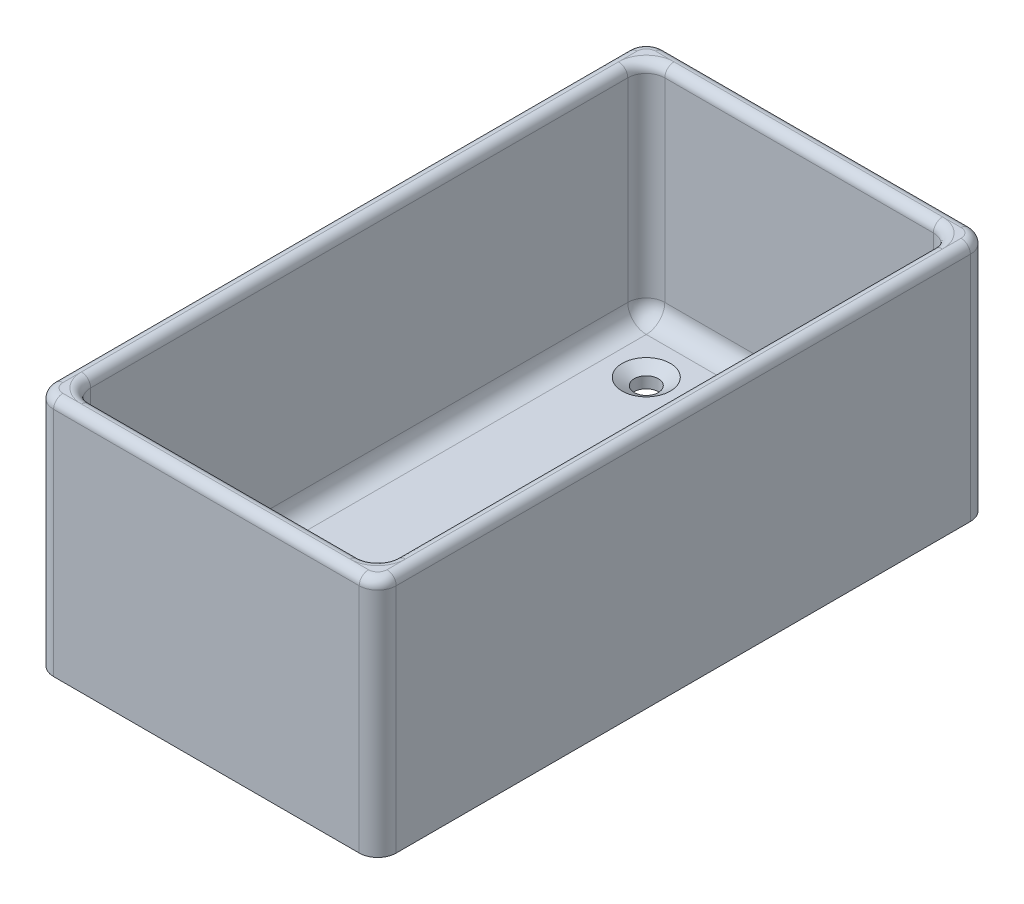
from build123d import *

# Parameters (mm, degrees)
SKETCH1_W           = 58.7375
SKETCH1_H           = 104.775
SKETCH1_W_2         = 52.3875
SKETCH1_H_2         = 98.425
EXTRUDE_THIN1_DEPTH = 38.1
FILLET1_R           = 3.175
BOSS_EXTRUDE1_DEPTH = 3.175
FILLET2_R           = 3.175
SKETCH3_R           = 2.06375
CUT_EXTRUDE1_DEPTH  = 3.175
CIRPATTERN1_COUNT   = 2
FILLET3_R           = 1.5875


with BuildPart() as part:
    # Sketch1 → Extrude-Thin1 (new body)
    with BuildSketch(Plane(origin=(0, 0, 0), x_dir=(1, 0, 0), z_dir=(0, 1, 0))):
        Rectangle(SKETCH1_W, SKETCH1_H)
        Rectangle(SKETCH1_W_2, SKETCH1_H_2, mode=Mode.SUBTRACT)
    extrude(amount=EXTRUDE_THIN1_DEPTH)

    # Fillet1
    fillet1_edges = [part.edges().sort_by_distance(p)[0] for p in [
        (26.19375, 19.05, 49.2125),
        (26.19375, 19.05, -49.2125),
        (-26.19375, 19.05, -49.2125),
        (-26.19375, 19.05, 49.2125),
        (29.36875, 19.05, 52.3875),
        (-29.36875, 19.05, 52.3875),
        (-29.36875, 19.05, -52.3875),
        (29.36875, 19.05, -52.3875),
    ]]
    fillet(fillet1_edges, radius=FILLET1_R)

    # Sketch2 → Boss-Extrude1 (add)
    with BuildSketch(Plane.XZ):
        with BuildLine():
            Line((29.36875, -49.2125), (29.36875, 49.2125))
            ThreePointArc((29.36875, 49.2125), (28.43881403, 51.45756403), (26.19375, 52.3875))
            Line((26.19375, 52.3875), (-26.19375, 52.3875))
            ThreePointArc((-26.19375, 52.3875), (-28.43881403, 51.45756403), (-29.36875, 49.2125))
            Line((-29.36875, 49.2125), (-29.36875, -49.2125))
            ThreePointArc((-29.36875, -49.2125), (-28.43881403, -51.45756403), (-26.19375, -52.3875))
            Line((-26.19375, -52.3875), (26.19375, -52.3875))
            ThreePointArc((26.19375, -52.3875), (28.43881403, -51.45756403), (29.36875, -49.2125))
        make_face()
    extrude(amount=BOSS_EXTRUDE1_DEPTH)

    # Fillet2
    fillet2_edges = [part.edges().sort_by_distance(p)[0] for p in [
        (26.19375, 0, 0),
        (0, 0, -49.2125),
        (-26.19375, 0, 0),
        (0, 0, 49.2125),
        (-25.26381403, 0, 48.28256403),
        (25.26381403, 0, 48.28256403),
        (25.26381403, 0, -48.28256403),
        (-25.26381403, 0, -48.28256403),
    ]]
    fillet(fillet2_edges, radius=FILLET2_R)

    # Sketch3 → Cut-Extrude1 (cut)
    with BuildSketch(Plane(origin=(0, 0, 0), x_dir=(1, 0, 0), z_dir=(0, 1, 0))):
        with Locations(Location((-16.66875, 39.6875, 0), (0, 0, 270))):
            Circle(SKETCH3_R)
    cut_extrude1 = extrude(amount=-CUT_EXTRUDE1_DEPTH, mode=Mode.SUBTRACT)

    # Sketch4 → Cut-Revolve1 (revolve, cut)
    with BuildSketch(Plane.YX.offset(39.6875), mode=Mode.PRIVATE) as cut_revolve1_sk:
        Polygon((-2.480052205, -16.66875), (0, -12.54125), (0, -16.66875), align=None)
    cut_revolve1 = revolve(cut_revolve1_sk.sketch.rotate(Axis((-16.66875, 0, -39.6875), (0, -1, 0)), 90), axis=Axis((-16.66875, 0, -39.6875), (0, -1, 0)), mode=Mode.SUBTRACT)

    # CirPattern1: Cut-Extrude1, Cut-Revolve1 ×2 about axis
    cirpattern1_axis = Axis((0, 0, 0), (0, 1, 0))
    add([cut_extrude1.rotate(cirpattern1_axis, i * 360 / CIRPATTERN1_COUNT) for i in range(1, CIRPATTERN1_COUNT)], mode=Mode.SUBTRACT)
    add([cut_revolve1.rotate(cirpattern1_axis, i * 360 / CIRPATTERN1_COUNT) for i in range(1, CIRPATTERN1_COUNT)], mode=Mode.SUBTRACT)

    # Fillet3
    fillet3_edges = [part.edges().sort_by_distance(p)[0] for p in [
        (29.36875, 38.1, 0),
        (0, 38.1, 52.3875),
        (0, 38.1, -52.3875),
        (-29.36875, 38.1, 0),
        (0, 38.1, -49.2125),
        (26.19375, 38.1, 0),
        (0, 38.1, 49.2125),
        (-26.19375, 38.1, 0),
        (-28.43881403, 38.1, 51.45756403),
        (28.43881403, 38.1, -51.45756403),
        (-28.43881403, 38.1, -51.45756403),
        (28.43881403, 38.1, 51.45756403),
        (-25.26381403, 38.1, 48.28256403),
        (25.26381403, 38.1, 48.28256403),
        (25.26381403, 38.1, -48.28256403),
        (-25.26381403, 38.1, -48.28256403),
    ]]
    fillet(fillet3_edges, radius=FILLET3_R - 0.0001)  # a hair under: the kernel refuses the full size


solid = part.part
